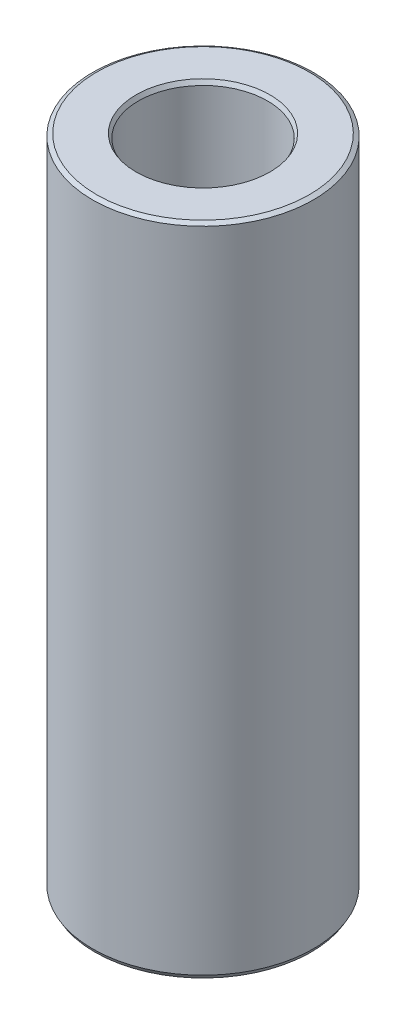
from build123d import *
from OCP.BRepFilletAPI import BRepFilletAPI_MakeChamfer

# Parameters (mm, degrees)
SKETCH1_R           = 45
BOSS_EXTRUDE1_DEPTH = 266.951392019
SKETCH2_R           = 26.306445695
CUT_EXTRUDE1_DEPTH  = 275.432224239
CHAMFER1_SIZE       = 0.970015884
CHAMFER1_SIZE2      = 1.680116795


with BuildPart() as part:
    # Sketch1 → Boss-Extrude1 (new body)
    with BuildSketch(Plane(origin=(0, 0, 0), x_dir=(1, 0, 0), z_dir=(0, 1, 0))):
        Circle(SKETCH1_R)
    extrude(amount=BOSS_EXTRUDE1_DEPTH)

    # Sketch2 → Cut-Extrude1 (cut, through all)
    with BuildSketch(Plane(origin=(0, 0, 0), x_dir=(1, 0, 0), z_dir=(0, 1, 0))):
        Circle(SKETCH2_R)
    extrude(amount=CUT_EXTRUDE1_DEPTH, mode=Mode.SUBTRACT)

    # Chamfer1: one chamfer whose edges measure the first distance from different faces: ONE call of the kernel's chamfer builder (chamfer() names one face for all edges)
    chamfer1_edges_1 = [part.edges().sort_by_distance(p)[0] for p in [
        (-26.306445695, 266.951392019, 0),
    ]]
    chamfer1_side_1 = [part.faces().sort_by_distance(p)[0] for p in [
        (-43.727207794, 266.951392019, 0),
    ]]
    chamfer1_edges_2 = [part.edges().sort_by_distance(p)[0] for p in [
        (-26.306445695, 0, 0),
    ]]
    chamfer1_side_2 = [part.faces().sort_by_distance(p)[0] for p in [
        (-26.306445695, 133.475696009, 0),
    ]]
    chamfer1_edges_3 = [part.edges().sort_by_distance(p)[0] for p in [
        (-45, 0, 0),
    ]]
    chamfer1_side_3 = [part.faces().sort_by_distance(p)[0] for p in [
        (-43.727207794, 0, 0),
    ]]
    chamfer1_edges_4 = [part.edges().sort_by_distance(p)[0] for p in [
        (-45, 266.951392019, 0),
    ]]
    chamfer1_side_4 = [part.faces().sort_by_distance(p)[0] for p in [
        (-45, 133.475696009, 0),
    ]]
    chamfer1 = BRepFilletAPI_MakeChamfer(part.part.solid().wrapped)
    for e in chamfer1_edges_1:
        chamfer1.Add(CHAMFER1_SIZE, CHAMFER1_SIZE2, e.wrapped, chamfer1_side_1[0].wrapped)  # the first distance lies on this face
    for e in chamfer1_edges_2:
        chamfer1.Add(CHAMFER1_SIZE, CHAMFER1_SIZE2, e.wrapped, chamfer1_side_2[0].wrapped)  # the first distance lies on this face
    for e in chamfer1_edges_3:
        chamfer1.Add(CHAMFER1_SIZE, CHAMFER1_SIZE2, e.wrapped, chamfer1_side_3[0].wrapped)  # the first distance lies on this face
    for e in chamfer1_edges_4:
        chamfer1.Add(CHAMFER1_SIZE, CHAMFER1_SIZE2, e.wrapped, chamfer1_side_4[0].wrapped)  # the first distance lies on this face
    add(Compound.cast(chamfer1.Shape()), mode=Mode.REPLACE)


solid = part.part
